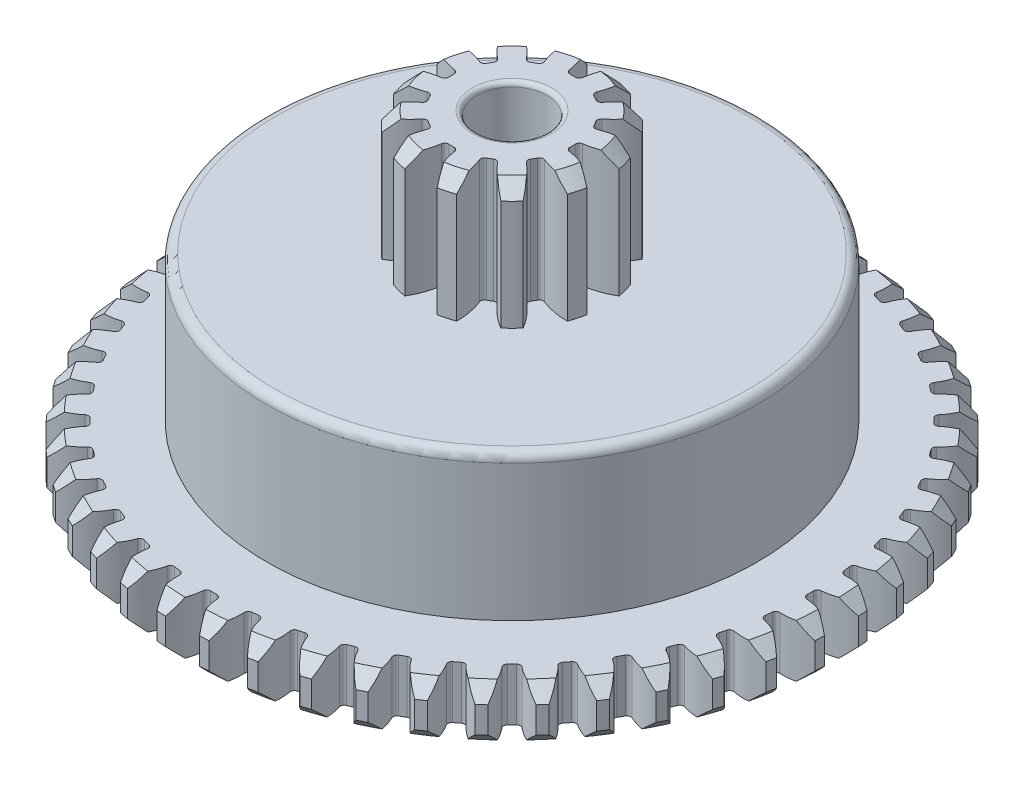
from build123d import *

# Parameters (mm, degrees)
SKETCH1_R                = 2.1
BOSS_EXTRUDE1_DEPTH      = 2.8
CUT_EXTRUDE1_REACH       = 6.082
FILLET1_R                = 0.09
CHAMFER1_SIZE            = 0.3
CIRPATTERN1_COUNT        = 12
FILLET1_OF_CIRPATTERN1_R = 0.09
SKETCH3_R                = 5.575
BOSS_EXTRUDE2_DEPTH      = 3.3
FILLET2_R                = 0.2
SKETCH4_R                = 7.5
BOSS_EXTRUDE3_DEPTH      = 1.2
CUT_EXTRUDE3_REACH       = 14.876
FILLET3_R                = 0.09
CHAMFER2_SIZE            = 0.3
CIRPATTERN3_COUNT        = 48
FILLET3_OF_CIRPATTERN3_R = 0.09
SKETCH6_R                = 4.5
CUT_EXTRUDE4_DEPTH       = 3.4
SKETCH7_R                = 0.8
CUT_EXTRUDE5_DEPTH       = 13.864316436
FILLET4_R                = 0.1


with BuildPart() as part:
    # Sketch1 → Boss-Extrude1 (new body)
    with BuildSketch(Plane(origin=(0, 0, 0), x_dir=(1, 0, 0), z_dir=(0, 1, 0))):
        Circle(SKETCH1_R)
    extrude(amount=BOSS_EXTRUDE1_DEPTH)

    # Sketch2 → Cut-Extrude1 (cut, up to next)
    with BuildSketch(Plane(origin=(0, 2.8, 0), x_dir=(1, 0, 0), z_dir=(0, 1, 0)), mode=Mode.PRIVATE) as cut_extrude1_sk1:
        with BuildLine():
            ThreePointArc((-0.140478266, 1.372831329), (-0.216904263, 1.732429305), (-0.368251981, 2.06745991))
            ThreePointArc((-0.368251981, 2.06745991), (0, 2.1), (0.368251981, 2.06745991))
            ThreePointArc((0.368251981, 2.06745991), (0.216904263, 1.732429305), (0.140478266, 1.372831329))
            ThreePointArc((0.140478266, 1.372831329), (0, 1.38), (-0.140478266, 1.372831329))
        make_face()
    cut_extrude1_tool1 = extrude(cut_extrude1_sk1.sketch, amount=-CUT_EXTRUDE1_REACH, mode=Mode.PRIVATE) & part.part
    cut_extrude1 = cut_extrude1_tool1.solids().sort_by_distance((0, 2.8, -1.794061))[0]
    add(cut_extrude1, mode=Mode.SUBTRACT)

    # Fillet1
    fillet1_edges = [part.edges().sort_by_distance(p)[0] for p in [
        (0.140478266, 1.4, -1.372831329),
        (-0.140478266, 1.4, -1.372831329),
    ]]
    fillet(fillet1_edges, radius=FILLET1_R)

    # Chamfer1
    chamfer1_edges = [part.edges().sort_by_distance(p)[0] for p in [
        (0, 2.8, 2.1),
    ]]
    chamfer(chamfer1_edges, length=CHAMFER1_SIZE)

    # CirPattern1: Cut-Extrude1 ×12 about axis
    cirpattern1_axis = Axis((0, 2.8, 0), (0, -1, 0))
    for i in range(1, CIRPATTERN1_COUNT):
        add(cut_extrude1.rotate(cirpattern1_axis, i * 360 / CIRPATTERN1_COUNT), mode=Mode.SUBTRACT)

    # Fillet1 of CirPattern1
    fillet1_of_cirpattern1_edges = [part.edges().sort_by_distance(p)[0] for p in [
        (0.808073411, 1.4, -1.118667673),
        (0.564757917, 1.4, -1.259145939),
        (1.259145939, 1.4, -0.564757917),
        (1.118667673, 1.4, -0.808073411),
        (1.372831329, 1.4, 0.140478266),
        (1.372831329, 1.4, -0.140478266),
        (1.118667673, 1.4, 0.808073411),
        (1.259145939, 1.4, 0.564757917),
        (0.564757917, 1.4, 1.259145939),
        (0.808073411, 1.4, 1.118667673),
        (-0.140478266, 1.4, 1.372831329),
        (0.140478266, 1.4, 1.372831329),
        (-0.808073411, 1.4, 1.118667673),
        (-0.564757917, 1.4, 1.259145939),
        (-1.259145939, 1.4, 0.564757917),
        (-1.118667673, 1.4, 0.808073411),
        (-1.372831329, 1.4, -0.140478266),
        (-1.372831329, 1.4, 0.140478266),
        (-1.118667673, 1.4, -0.808073411),
        (-1.259145939, 1.4, -0.564757917),
        (-0.564757917, 1.4, -1.259145939),
        (-0.808073411, 1.4, -1.118667673),
    ]]
    fillet(fillet1_of_cirpattern1_edges, radius=FILLET1_OF_CIRPATTERN1_R)

    # Sketch3 → Boss-Extrude2 (add)
    with BuildSketch(Plane.XZ):
        Circle(SKETCH3_R)
    extrude(amount=BOSS_EXTRUDE2_DEPTH)

    # Fillet2
    fillet2_edges = [part.edges().sort_by_distance(p)[0] for p in [
        (-5.575, 0, 0),
    ]]
    fillet(fillet2_edges, radius=FILLET2_R)

    # Sketch4 → Boss-Extrude3 (add)
    with BuildSketch(Plane.XZ.offset(3.3)):
        Circle(SKETCH4_R)
    extrude(amount=BOSS_EXTRUDE3_DEPTH)

    # Sketch8 → Cut-Extrude3 (cut, up to next)
    with BuildSketch(Plane.XZ.offset(4.5), mode=Mode.PRIVATE) as cut_extrude3_sk1:
        with BuildLine():
            ThreePointArc((-0.156882898, 6.778184695), (-0.220024737, 7.150857077), (-0.38688957, 7.49001445))
            ThreePointArc((-0.38688957, 7.49001445), (0, 7.5), (0.38688957, 7.49001445))
            ThreePointArc((0.38688957, 7.49001445), (0.220024737, 7.150857077), (0.156882898, 6.778184695))
            ThreePointArc((0.156882898, 6.778184695), (0, 6.78), (-0.156882898, 6.778184695))
        make_face()
    cut_extrude3_tool1 = extrude(cut_extrude3_sk1.sketch, amount=-CUT_EXTRUDE3_REACH, mode=Mode.PRIVATE) & part.part
    cut_extrude3 = cut_extrude3_tool1.solids().sort_by_distance((0, -4.5, 7.196505))[0]
    add(cut_extrude3, mode=Mode.SUBTRACT)

    # Fillet3
    fillet3_edges = [part.edges().sort_by_distance(p)[0] for p in [
        (0.156882898, -3.9, 6.778184695),
        (-0.156882898, -3.9, 6.778184695),
    ]]
    fillet(fillet3_edges, radius=FILLET3_R)

    # Chamfer2
    chamfer2_edges = [part.edges().sort_by_distance(p)[0] for p in [
        (-5.164703681, -3.3, -5.438367024),
        (-5.164703681, -4.5, -5.438367024),
    ]]
    chamfer(chamfer2_edges, length=CHAMFER2_SIZE)

    # CirPattern3: Cut-Extrude3 ×48 about axis
    cirpattern3_axis = Axis((0, -4.5, 0), (0, 1, 0))
    for i in range(1, CIRPATTERN3_COUNT):
        add(cut_extrude3.rotate(cirpattern3_axis, i * 360 / CIRPATTERN3_COUNT), mode=Mode.SUBTRACT)

    # Fillet3 of CirPattern3
    fillet3_of_cirpattern3_edges = [part.edges().sort_by_distance(p)[0] for p in [
        (1.040271382, -3.9, 6.699719058),
        (0.729189895, -3.9, 6.740673712),
        (1.905860533, -3.9, 6.50661937),
        (1.602786047, -3.9, 6.587827934),
        (2.738839883, -3.9, 6.202189621),
        (2.448958086, -3.9, 6.322262593),
        (3.524956923, -3.9, 5.791638688),
        (3.253227772, -3.9, 5.948521586),
        (4.250760972, -3.9, 5.281991211),
        (4.00183383, -3.9, 5.472999726),
        (4.903833323, -3.9, 4.681967401),
        (4.681967401, -3.9, 4.903833323),
        (5.472999726, -3.9, 4.00183383),
        (5.281991211, -3.9, 4.250760972),
        (5.948521586, -3.9, 3.253227772),
        (5.791638688, -3.9, 3.524956923),
        (6.322262593, -3.9, 2.448958086),
        (6.202189621, -3.9, 2.738839883),
        (6.587827934, -3.9, 1.602786047),
        (6.50661937, -3.9, 1.905860533),
        (6.740673712, -3.9, 0.729189895),
        (6.699719058, -3.9, 1.040271382),
        (6.778184695, -3.9, -0.156882898),
        (6.778184695, -3.9, 0.156882898),
        (6.699719058, -3.9, -1.040271382),
        (6.740673712, -3.9, -0.729189895),
        (6.50661937, -3.9, -1.905860533),
        (6.587827934, -3.9, -1.602786047),
        (6.202189621, -3.9, -2.738839883),
        (6.322262593, -3.9, -2.448958086),
        (5.791638688, -3.9, -3.524956923),
        (5.948521586, -3.9, -3.253227772),
        (5.281991211, -3.9, -4.250760972),
        (5.472999726, -3.9, -4.00183383),
        (4.681967401, -3.9, -4.903833323),
        (4.903833323, -3.9, -4.681967401),
        (4.00183383, -3.9, -5.472999726),
        (4.250760972, -3.9, -5.281991211),
        (3.253227772, -3.9, -5.948521586),
        (3.524956923, -3.9, -5.791638688),
        (2.448958086, -3.9, -6.322262593),
        (2.738839883, -3.9, -6.202189621),
        (1.602786047, -3.9, -6.587827934),
        (1.905860533, -3.9, -6.50661937),
        (0.729189895, -3.9, -6.740673712),
        (1.040271382, -3.9, -6.699719058),
        (-0.156882898, -3.9, -6.778184695),
        (0.156882898, -3.9, -6.778184695),
        (-1.040271382, -3.9, -6.699719058),
        (-0.729189895, -3.9, -6.740673712),
        (-1.905860533, -3.9, -6.50661937),
        (-1.602786047, -3.9, -6.587827934),
        (-2.738839883, -3.9, -6.202189621),
        (-2.448958086, -3.9, -6.322262593),
        (-3.524956923, -3.9, -5.791638688),
        (-3.253227772, -3.9, -5.948521586),
        (-4.250760972, -3.9, -5.281991211),
        (-4.00183383, -3.9, -5.472999726),
        (-4.903833323, -3.9, -4.681967401),
        (-4.681967401, -3.9, -4.903833323),
        (-5.472999726, -3.9, -4.00183383),
        (-5.281991211, -3.9, -4.250760972),
        (-5.948521586, -3.9, -3.253227772),
        (-5.791638688, -3.9, -3.524956923),
        (-6.322262593, -3.9, -2.448958086),
        (-6.202189621, -3.9, -2.738839883),
        (-6.587827934, -3.9, -1.602786047),
        (-6.50661937, -3.9, -1.905860533),
        (-6.740673712, -3.9, -0.729189895),
        (-6.699719058, -3.9, -1.040271382),
        (-6.778184695, -3.9, 0.156882898),
        (-6.778184695, -3.9, -0.156882898),
        (-6.699719058, -3.9, 1.040271382),
        (-6.740673712, -3.9, 0.729189895),
        (-6.50661937, -3.9, 1.905860533),
        (-6.587827934, -3.9, 1.602786047),
        (-6.202189621, -3.9, 2.738839883),
        (-6.322262593, -3.9, 2.448958086),
        (-5.791638688, -3.9, 3.524956923),
        (-5.948521586, -3.9, 3.253227772),
        (-5.281991211, -3.9, 4.250760972),
        (-5.472999726, -3.9, 4.00183383),
        (-4.681967401, -3.9, 4.903833323),
        (-4.903833323, -3.9, 4.681967401),
        (-4.00183383, -3.9, 5.472999726),
        (-4.250760972, -3.9, 5.281991211),
        (-3.253227772, -3.9, 5.948521586),
        (-3.524956923, -3.9, 5.791638688),
        (-2.448958086, -3.9, 6.322262593),
        (-2.738839883, -3.9, 6.202189621),
        (-1.602786047, -3.9, 6.587827934),
        (-1.905860533, -3.9, 6.50661937),
        (-0.729189895, -3.9, 6.740673712),
        (-1.040271382, -3.9, 6.699719058),
    ]]
    fillet(fillet3_of_cirpattern3_edges, radius=FILLET3_OF_CIRPATTERN3_R)

    # Sketch6 → Cut-Extrude4 (cut)
    with BuildSketch(Plane.XZ.offset(4.5)):
        Circle(SKETCH6_R)
    extrude(amount=-CUT_EXTRUDE4_DEPTH, mode=Mode.SUBTRACT)

    # Sketch7 → Cut-Extrude5 (cut, through all)
    with BuildSketch(Plane(origin=(0, 2.8, 0), x_dir=(1, 0, 0), z_dir=(0, 1, 0))):
        Circle(SKETCH7_R)
    extrude(amount=-CUT_EXTRUDE5_DEPTH, mode=Mode.SUBTRACT)

    # Fillet4
    fillet4_edges = [part.edges().sort_by_distance(p)[0] for p in [
        (-0.8, 2.8, 0),
        (-4.5, -4.5, 0),
    ]]
    fillet(fillet4_edges, radius=FILLET4_R)


solid = part.part
